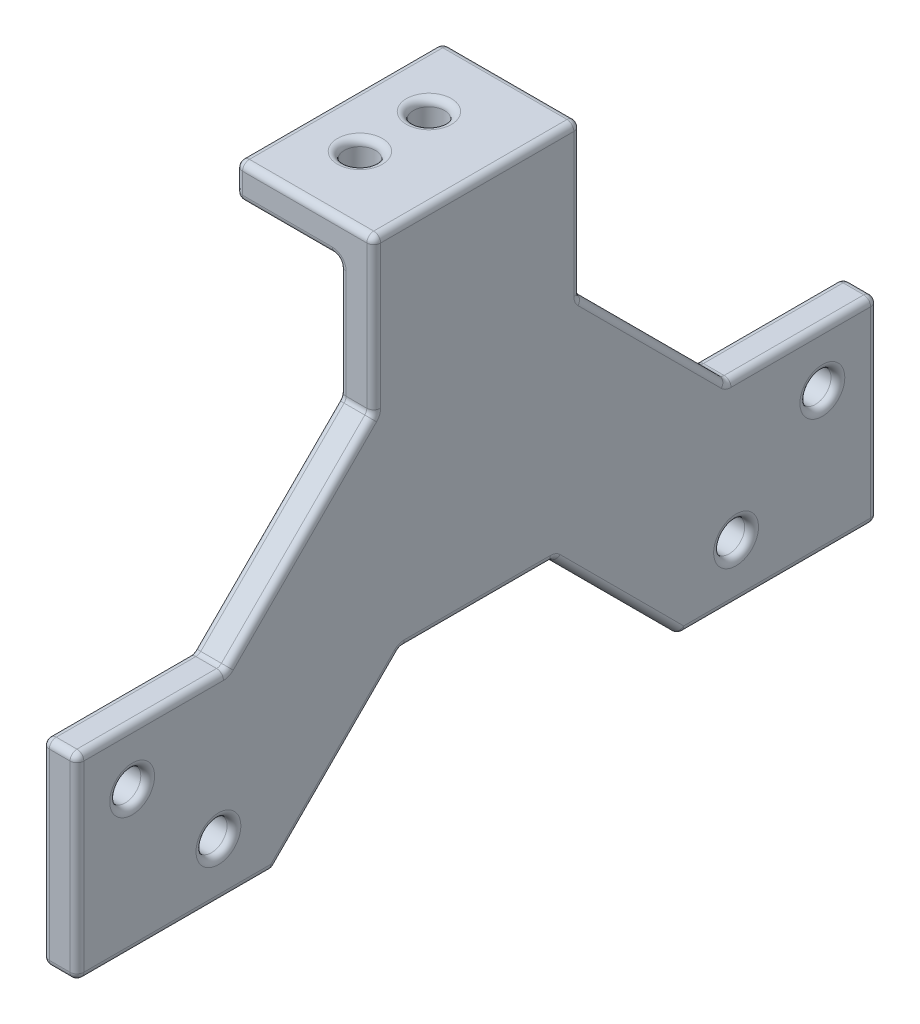
from build123d import *

# Parameters (mm, degrees)
SKETCH2_R           = 2.25
BOSS_EXTRUDE2_DEPTH = 5
SKETCH3_W           = 30
SKETCH3_H           = 5
BOSS_EXTRUDE6_DEPTH = 15
SKETCH4_R           = 2.25
CUT_EXTRUDE1_DEPTH  = 10
FILLET5_R           = 1


with BuildPart() as part:
    # Sketch2 → Boss-Extrude2 (new body)
    with BuildSketch(Plane(origin=(0, 0, 0), x_dir=(0, 0, -1), z_dir=(1, 0, 0))):
        Polygon((0, 0), (0, 28.5), (21.644660941, 28.5), (43, 49.855339059), (43, 72), (73, 72), (73, 49.855339059), (94.355339059, 28.5), (116, 28.5), (116, 0), (87.5, 0), (69, 18.5), (47, 18.5), (28.5, 0), align=None)
        with Locations((20.5, 8)):
            Circle(SKETCH2_R, mode=Mode.SUBTRACT)
        with Locations((8, 20.5)):
            Circle(SKETCH2_R, mode=Mode.SUBTRACT)
        with Locations((95.5, 8)):
            Circle(SKETCH2_R, mode=Mode.SUBTRACT)
        with Locations((108, 20.5)):
            Circle(SKETCH2_R, mode=Mode.SUBTRACT)
    extrude(amount=BOSS_EXTRUDE2_DEPTH)

    # Sketch3 → Boss-Extrude6 (add)
    with BuildSketch(Plane.ZY):
        with Locations((-58, 69.5)):
            Rectangle(SKETCH3_W, SKETCH3_H)
    extrude(amount=BOSS_EXTRUDE6_DEPTH)

    # Sketch4 → Cut-Extrude1 (cut)
    with BuildSketch(Plane.XZ.offset(-67)):
        with Locations((-7, -53)):
            Circle(SKETCH4_R)
        with Locations((-7, -63)):
            Circle(SKETCH4_R)
    extrude(amount=-CUT_EXTRUDE1_DEPTH, mode=Mode.SUBTRACT)

    # Fillet5
    fillet5_edges = [part.edges().sort_by_distance(p)[0] for p in [
        (0, 18.5, -58),
        (0, 39.17766953, -32.32233047),
        (0, 39.17766953, -83.67766953),
        (2.5, 28.5, -94.355339059),
        (0, 28.5, -105.17766953),
        (2.5, 28.5, -116),
        (0, 14.25, -116),
        (2.5, 18.5, -69),
        (0, 9.25, -78.25),
        (2.5, 0, -87.5),
        (2.5, 0, -116),
        (0, 0, -101.75),
        (2.5, 18.5, -47),
        (0, 9.25, -37.75),
        (2.5, 0, -28.5),
        (0, 0, -14.25),
        (2.5, 0, 0),
        (0, 14.25, 0),
        (2.5, 28.5, -21.644660941),
        (2.5, 28.5, 0),
        (0, 28.5, -10.82233047),
        (5, 20.5, -105.75),
        (5, 20.5, -5.75),
        (5, 14.25, 0),
        (5, 28.5, -10.82233047),
        (5, 39.17766953, -32.32233047),
        (5, 60.92766953, -43),
        (5, 72, -58),
        (5, 60.92766953, -73),
        (5, 39.17766953, -83.67766953),
        (5, 28.5, -105.17766953),
        (5, 14.25, -116),
        (5, 0, -101.75),
        (5, 9.25, -78.25),
        (5, 18.5, -58),
        (5, 9.25, -37.75),
        (5, 0, -14.25),
        (5, 8, -18.25),
        (5, 8, -93.25),
        (0, 8, -93.25),
        (0, 20.5, -105.75),
        (0, 20.5, -5.75),
        (0, 8, -18.25),
        (-5, 72, -43),
        (-15, 72, -58),
        (-5, 72, -73),
        (-9.25, 72, -63),
        (-9.25, 72, -53),
        (-7.5, 67, -73),
        (-7.5, 67, -43),
        (0, 67, -58),
        (-9.25, 67, -63),
        (-9.25, 67, -53),
        (-15, 69.5, -43),
        (-15, 67, -58),
        (-15, 69.5, -73),
        (0, 58.42766953, -73),
        (0, 58.42766953, -43),
        (2.5, 49.855339059, -43),
        (2.5, 49.855339059, -73),
    ]]
    fillet(fillet5_edges, radius=FILLET5_R)


solid = part.part
